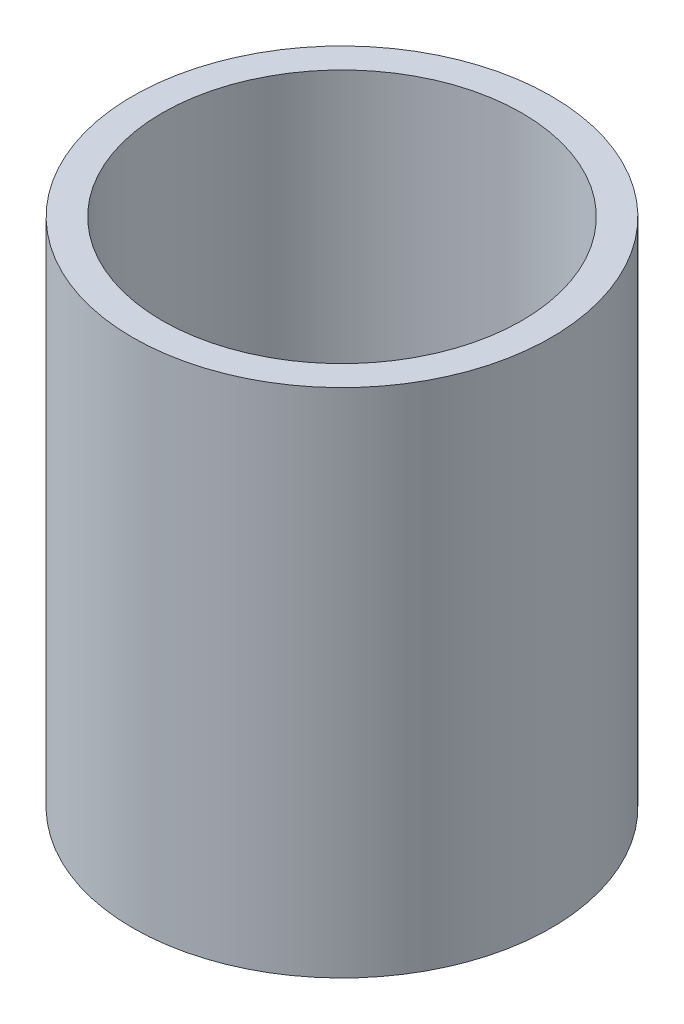
from build123d import *

# Parameters (mm, degrees)
SKETCH1_R           = 25
BOSS_EXTRUDE1_DEPTH = 61.096431778
SKETCH2_R           = 21.49161015
CUT_EXTRUDE1_DEPTH  = 71.588766641


with BuildPart() as part:
    # Sketch1 → Boss-Extrude1 (new body)
    with BuildSketch(Plane(origin=(0, 0, 0), x_dir=(1, 0, 0), z_dir=(0, 1, 0))):
        Circle(SKETCH1_R)
    extrude(amount=BOSS_EXTRUDE1_DEPTH)

    # Sketch2 → Cut-Extrude1 (cut, through all)
    with BuildSketch(Plane(origin=(0, 0, 0), x_dir=(1, 0, 0), z_dir=(0, 1, 0))):
        Circle(SKETCH2_R)
    extrude(amount=CUT_EXTRUDE1_DEPTH, mode=Mode.SUBTRACT)


solid = part.part
